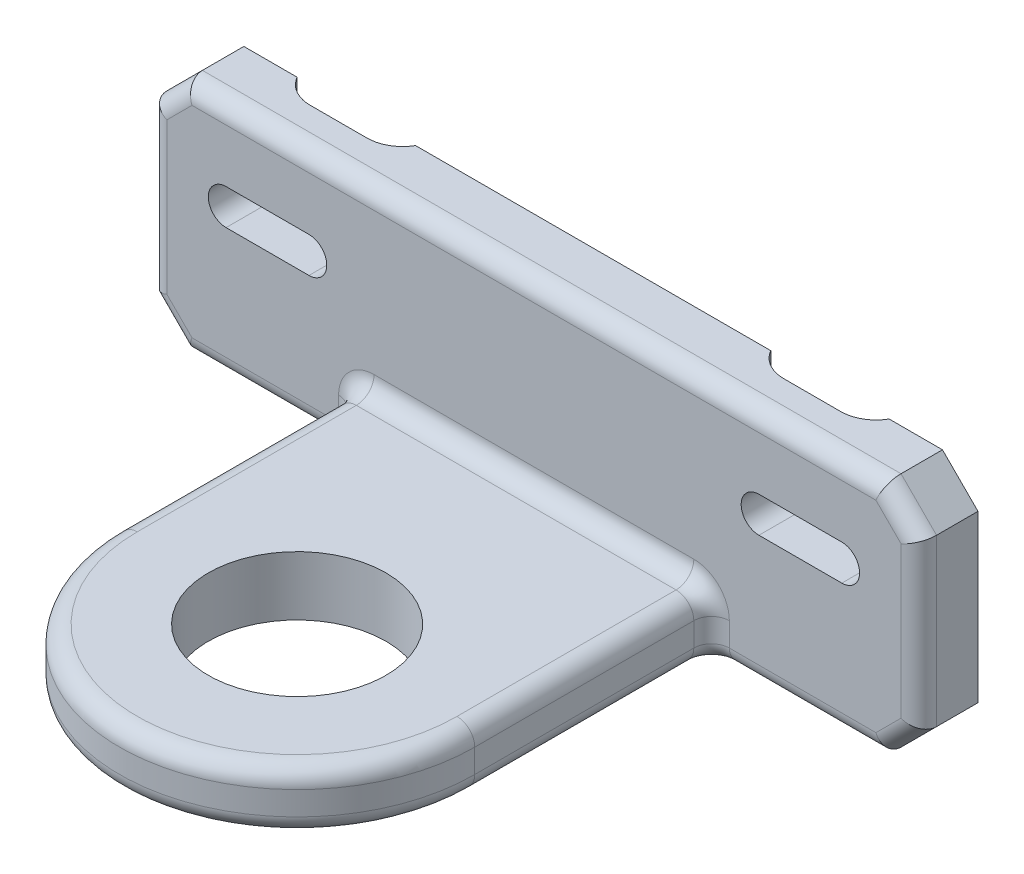
from build123d import *

# Parameters (mm, degrees)
ESQUISSE1_W             = 130
ESQUISSE1_H             = 40
BOSS_EXTRU_1_DEPTH      = 10
ESQUISSE2_R             = 15
BOSS_EXTRU_2_DEPTH      = 10
ENL_V_MAT_EXTRU_1_DEPTH = 98.59610648
ESQUISSE4_W             = 20
ESQUISSE4_H             = 3
ENL_V_MAT_EXTRU_2_DEPTH = 111.566721937
CONG_1_R                = 6
CONG_1_OF_SYM_TRIE2_R   = 6
CHANFREIN1_SIZE         = 6
CONG_2_R                = 3


with BuildPart() as part:
    # Esquisse1 → Boss.-Extru.1 (new body)
    with BuildSketch(Plane.XY):
        Rectangle(ESQUISSE1_W, ESQUISSE1_H)
    extrude(amount=BOSS_EXTRU_1_DEPTH)

    # Esquisse2 → Boss.-Extru.2 (add)
    with BuildSketch(Plane.XZ.offset(20)):
        with BuildLine():
            Line((-30, 0), (-30, 50))
            ThreePointArc((-30, 50), (0, 80), (30, 50))
            Line((30, 50), (30, 0))
            Line((30, 0), (-30, 0))
        make_face()
        with Locations(Location((0, 50, 0), (0, 0, 270))):
            Circle(ESQUISSE2_R, mode=Mode.SUBTRACT)
    extrude(amount=-BOSS_EXTRU_2_DEPTH)

    # Esquisse3 → Enlèv. mat.-Extru.1 (cut, through all)
    with BuildSketch(Plane.XY.offset(10)):
        with BuildLine():
            Line((38, 8), (52, 8))
            ThreePointArc((52, 8), (55, 5), (52, 2))
            Line((52, 2), (38, 2))
            ThreePointArc((38, 2), (35, 5), (38, 8))
        make_face()
    enl_v_mat_extru_1 = extrude(amount=-ENL_V_MAT_EXTRU_1_DEPTH, mode=Mode.SUBTRACT)

    # Symétrie1: Enlèv. mat.-Extru.1 across plane
    add(enl_v_mat_extru_1.mirror(Plane(origin=(0, 0, 0), x_dir=(0, 0, 1), z_dir=(1, 0, 0))), mode=Mode.SUBTRACT)

    # Esquisse4 → Enlèv. mat.-Extru.2 (cut, through all)
    with BuildSketch(Plane.XZ.offset(20)):
        with Locations((40, 1.5)):
            Rectangle(ESQUISSE4_W, ESQUISSE4_H)
    enl_v_mat_extru_2 = extrude(amount=-ENL_V_MAT_EXTRU_2_DEPTH, mode=Mode.SUBTRACT)

    # Congé1
    # the kernel refuses this fillet: 6 mm, written as the material it adds along each edge
    with BuildSketch(Plane(origin=(50, -20, 3), x_dir=(-1, 0, 0), z_dir=(0, 1, 0))) as cong_1_piece_1:
        with BuildLine():
            CenterArc((5.196152423, -6), CONG_1_R, 90, 60)
            Line((0, -3), (-0.103923048, -2.94))
            ThreePointArc((-0.103923048, -2.94), (-0.12, -1.5), (-0.12, 0))
            Line((-0.12, 0), (0, 0.12))
            Line((0, 0.12), (5.196152423, 0.12))
            Line((5.196152423, 0.12), (5.196152423, 0))
        make_face()
    extrude(amount=22)
    with BuildSketch(Plane(origin=(50, -20, 3), x_dir=(-1, 0, 0), z_dir=(0, 1, 0))) as cong_1_piece_2_section:
        with BuildLine():
            CenterArc((5.196152423, -6), CONG_1_R, 90, 60)
            Line((0, -3), (-0.103923048, -2.94))
            ThreePointArc((-0.103923048, -2.94), (-0.12, -1.5), (-0.12, 0))
            Line((-0.12, 0), (0, 0.12))
            Line((0, 0.12), (5.196152423, 0.12))
            Line((5.196152423, 0.12), (5.196152423, 0))
        make_face()
    cong_1_piece_2 = extrude(amount=34.990381057, mode=Mode.PRIVATE)
    cong_1_piece_2 = split(cong_1_piece_2, bisect_by=Plane(origin=(48.702137325, 8, 2.222899734), z_dir=(0, 1, 0)), keep=Keep.TOP, mode=Mode.PRIVATE)
    add(cong_1_piece_2)
    with BuildSketch(Plane(origin=(50, -4.990381057, 3), x_dir=(-1, 0, 0), z_dir=(0, 1, 0))) as cong_1_piece_3_section:
        with BuildLine():
            CenterArc((5.196152423, -6), CONG_1_R, 90, 60)
            Line((0, -3), (-0.103923048, -2.94))
            ThreePointArc((-0.103923048, -2.94), (-0.12, -1.5), (-0.12, 0))
            Line((-0.12, 0), (0, 0.12))
            Line((0, 0.12), (5.196152423, 0.12))
            Line((5.196152423, 0.12), (5.196152423, 0))
        make_face()
    cong_1_piece_3 = extrude(amount=24.990381057, mode=Mode.PRIVATE)
    cong_1_piece_3 = split(cong_1_piece_3, bisect_by=Plane(origin=(48.702137325, 2, 2.222899734), z_dir=(0, -1, 0)), keep=Keep.TOP, mode=Mode.PRIVATE)
    add(cong_1_piece_3)
    with BuildSketch(Plane(origin=(50, 8, 3), x_dir=(-1, 0, 0), z_dir=(0, 1, 0))) as cong_1_piece_4:
        with BuildLine():
            CenterArc((5.196152423, -6), CONG_1_R, 90, 60)
            Line((0, -3), (-0.103923048, -2.94))
            ThreePointArc((-0.103923048, -2.94), (-0.12, -1.5), (-0.12, 0))
            Line((-0.12, 0), (0, 0.12))
            Line((0, 0.12), (5.196152423, 0.12))
            Line((5.196152423, 0.12), (5.196152423, 0))
        make_face()
    extrude(amount=12)
    with BuildSketch(Plane(origin=(30, -20, 3), x_dir=(0, 0, -1), z_dir=(0, 1, 0))) as cong_1_piece_5_section:
        with BuildLine():
            CenterArc((6, -5.196152423), CONG_1_R, 120, 60)
            Line((0, -5.196152423), (-0.12, -5.196152423))
            Line((-0.12, -5.196152423), (-0.12, 0))
            Line((-0.12, 0), (0, 0.12))
            ThreePointArc((0, 0.12), (1.5, 0.12), (2.94, 0.103923048))
            Line((2.94, 0.103923048), (3, 0))
        make_face()
    cong_1_piece_5 = extrude(amount=40, mode=Mode.PRIVATE)
    cong_1_piece_5 = cong_1_piece_5 - Plane(origin=(38, 5, 2.222770997), x_dir=(0, -1, 0), z_dir=(0, 0, 1)) * Cylinder(3, 101, mode=Mode.PRIVATE)
    add(cong_1_piece_5)

    # Symétrie2: Enlèv. mat.-Extru.2 across plane
    add(enl_v_mat_extru_2.mirror(Plane(origin=(0, 0, 0), x_dir=(0, 0, 1), z_dir=(1, 0, 0))), mode=Mode.SUBTRACT)

    # Congé1 of Symétrie2
    # the kernel refuses this fillet: 6 mm, written as the material it adds along each edge
    with BuildSketch(Plane(origin=(-50, -20, 3), x_dir=(1, 0, 0), z_dir=(0, 1, 0))) as cong_1_of_sym_trie2_piece_1:
        with BuildLine():
            CenterArc((5.196152423, 6), CONG_1_OF_SYM_TRIE2_R, 210, 60)
            Line((0, 3), (-0.103923048, 2.94))
            ThreePointArc((-0.103923048, 2.94), (-0.12, 1.5), (-0.12, 0))
            Line((-0.12, 0), (0, -0.12))
            Line((0, -0.12), (5.196152423, -0.12))
            Line((5.196152423, -0.12), (5.196152423, 0))
        make_face()
    extrude(amount=22)
    with BuildSketch(Plane(origin=(-50, -20, 3), x_dir=(1, 0, 0), z_dir=(0, 1, 0))) as cong_1_of_sym_trie2_piece_2_section:
        with BuildLine():
            CenterArc((5.196152423, 6), CONG_1_OF_SYM_TRIE2_R, 210, 60)
            Line((0, 3), (-0.103923048, 2.94))
            ThreePointArc((-0.103923048, 2.94), (-0.12, 1.5), (-0.12, 0))
            Line((-0.12, 0), (0, -0.12))
            Line((0, -0.12), (5.196152423, -0.12))
            Line((5.196152423, -0.12), (5.196152423, 0))
        make_face()
    cong_1_of_sym_trie2_piece_2 = extrude(amount=34.990381057, mode=Mode.PRIVATE)
    cong_1_of_sym_trie2_piece_2 = split(cong_1_of_sym_trie2_piece_2, bisect_by=Plane(origin=(-48.702137325, 8, 2.222899734), z_dir=(0, 1, 0)), keep=Keep.TOP, mode=Mode.PRIVATE)
    add(cong_1_of_sym_trie2_piece_2)
    with BuildSketch(Plane(origin=(-50, -4.990381057, 3), x_dir=(1, 0, 0), z_dir=(0, 1, 0))) as cong_1_of_sym_trie2_piece_3_section:
        with BuildLine():
            CenterArc((5.196152423, 6), CONG_1_OF_SYM_TRIE2_R, 210, 60)
            Line((0, 3), (-0.103923048, 2.94))
            ThreePointArc((-0.103923048, 2.94), (-0.12, 1.5), (-0.12, 0))
            Line((-0.12, 0), (0, -0.12))
            Line((0, -0.12), (5.196152423, -0.12))
            Line((5.196152423, -0.12), (5.196152423, 0))
        make_face()
    cong_1_of_sym_trie2_piece_3 = extrude(amount=24.990381057, mode=Mode.PRIVATE)
    cong_1_of_sym_trie2_piece_3 = split(cong_1_of_sym_trie2_piece_3, bisect_by=Plane(origin=(-48.702137325, 2, 2.222899734), z_dir=(0, -1, 0)), keep=Keep.TOP, mode=Mode.PRIVATE)
    add(cong_1_of_sym_trie2_piece_3)
    with BuildSketch(Plane(origin=(-50, 8, 3), x_dir=(1, 0, 0), z_dir=(0, 1, 0))) as cong_1_of_sym_trie2_piece_4:
        with BuildLine():
            CenterArc((5.196152423, 6), CONG_1_OF_SYM_TRIE2_R, 210, 60)
            Line((0, 3), (-0.103923048, 2.94))
            ThreePointArc((-0.103923048, 2.94), (-0.12, 1.5), (-0.12, 0))
            Line((-0.12, 0), (0, -0.12))
            Line((0, -0.12), (5.196152423, -0.12))
            Line((5.196152423, -0.12), (5.196152423, 0))
        make_face()
    extrude(amount=12)
    with BuildSketch(Plane(origin=(-30, -20, 3), x_dir=(0, 0, -1), z_dir=(0, 1, 0))) as cong_1_of_sym_trie2_piece_5_section:
        with BuildLine():
            CenterArc((6, 5.196152423), CONG_1_OF_SYM_TRIE2_R, 180, 60)
            Line((0, 5.196152423), (-0.12, 5.196152423))
            Line((-0.12, 5.196152423), (-0.12, 0))
            Line((-0.12, 0), (0, -0.12))
            ThreePointArc((0, -0.12), (1.5, -0.12), (2.94, -0.103923048))
            Line((2.94, -0.103923048), (3, 0))
        make_face()
    cong_1_of_sym_trie2_piece_5 = extrude(amount=40, mode=Mode.PRIVATE)
    cong_1_of_sym_trie2_piece_5 = cong_1_of_sym_trie2_piece_5 - Plane(origin=(-38, 5, 2.222770997), x_dir=(0, -1, 0), z_dir=(0, 0, 1)) * Cylinder(3, 101, mode=Mode.PRIVATE)
    add(cong_1_of_sym_trie2_piece_5)

    # Chanfrein1
    chanfrein1_edges = [part.edges().sort_by_distance(p)[0] for p in [
        (-65, -20, 5),
        (65, -20, 5),
        (65, 20, 5),
        (-65, 20, 5),
    ]]
    chamfer(chanfrein1_edges, length=CHANFREIN1_SIZE)

    # Congé2
    cong_2_edges = [part.edges().sort_by_distance(p)[0] for p in [
        (-65, 0, 10),
        (0, 20, 10),
        (-44.5, -20, 10),
        (65, 0, 10),
        (-62, -17, 10),
        (62, -17, 10),
        (62, 17, 10),
        (-62, 17, 10),
        (44.5, -20, 10),
        (-30, -10, 30),
        (30, -10, 30),
        (-30, -20, 30),
        (30, -20, 30),
        (0, -20, 80),
        (-30, -15, 10),
        (0, -10, 80),
        (30, -15, 10),
        (0, -10, 10),
    ]]
    fillet(cong_2_edges, radius=CONG_2_R)


solid = part.part
